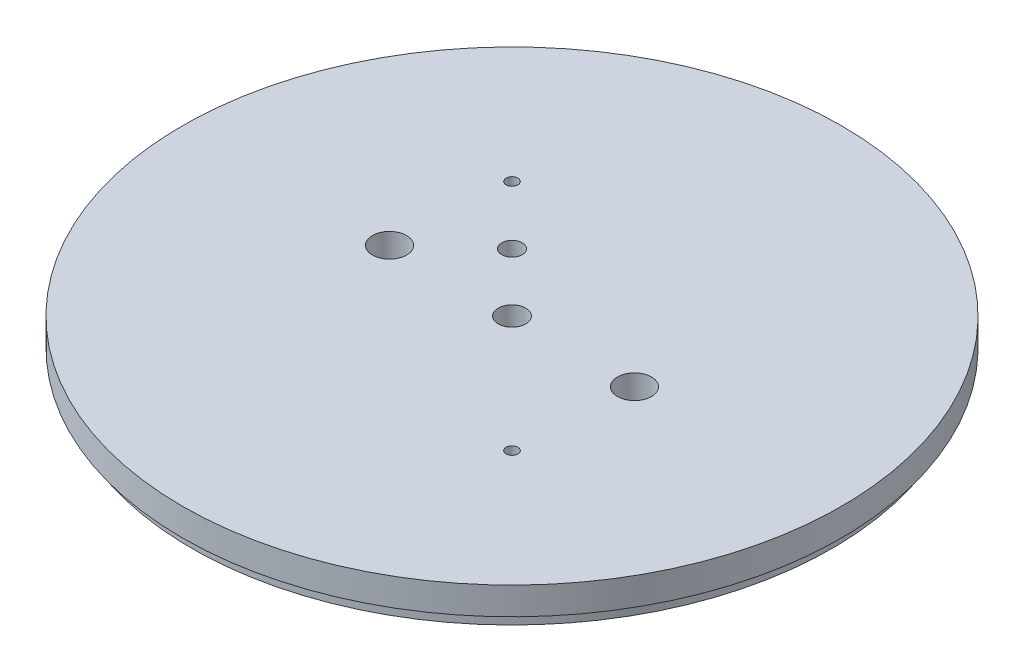
from build123d import *

# Parameters (mm, degrees)
SKETCH1_R           = 76.2
SKETCH1_R_2         = 3.175
SKETCH1_R_3         = 3.937
SKETCH1_R_4         = 1.3589
SKETCH1_R_5         = 2.38125
BOSS_EXTRUDE1_DEPTH = 9.525
SKETCH2_R           = 76.2
SKETCH2_R_2         = 74.041
CUT_EXTRUDE1_DEPTH  = 3.175
CUT_EXTRUDE2_START  = -5.969
CUT_EXTRUDE2_DEPTH  = 3.556


with BuildPart() as part:
    # Sketch1 → Boss-Extrude1 (new body)
    with BuildSketch(Plane(origin=(0, 0, 0), x_dir=(1, 0, 0), z_dir=(0, 1, 0))):
        Circle(SKETCH1_R)
        Circle(SKETCH1_R_2, mode=Mode.SUBTRACT)
        with Locations((28.321, 0)):
            Circle(SKETCH1_R_3, mode=Mode.SUBTRACT)
        with Locations((-28.321, 0)):
            Circle(SKETCH1_R_3, mode=Mode.SUBTRACT)
        with Locations((-26.940768363, 26.940768363)):
            Circle(SKETCH1_R_4, mode=Mode.SUBTRACT)
        with Locations((26.940768363, -26.940768363)):
            Circle(SKETCH1_R_4, mode=Mode.SUBTRACT)
        with Locations((-13.470384182, 13.470384182)):
            Circle(SKETCH1_R_5, mode=Mode.SUBTRACT)
    extrude(amount=BOSS_EXTRUDE1_DEPTH)

    # Sketch2 → Cut-Extrude1 (cut)
    with BuildSketch(Plane.XZ):
        Circle(SKETCH2_R)
        Circle(SKETCH2_R_2, mode=Mode.SUBTRACT)
    extrude(amount=-CUT_EXTRUDE1_DEPTH, mode=Mode.SUBTRACT)

    # Sketch3 → Cut-Extrude2 (cut)
    with BuildSketch(Plane(origin=(0, 9.525, 0), x_dir=(1, 0, 0), z_dir=(0, 1, 0)).offset(CUT_EXTRUDE2_START)):
        with BuildLine():
            Line((3.2385, 34.798), (3.2385, 13.97))
            ThreePointArc((3.2385, 13.97), (0, 10.7315), (-3.2385, 13.97))
            Line((-3.2385, 13.97), (-3.2385, 34.798))
            ThreePointArc((-3.2385, 34.798), (0, 38.0365), (3.2385, 34.798))
        make_face()
        with BuildLine():
            Line((3.2385, -34.798), (3.2385, -13.97))
            ThreePointArc((3.2385, -13.97), (0, -10.7315), (-3.2385, -13.97))
            Line((-3.2385, -13.97), (-3.2385, -34.798))
            ThreePointArc((-3.2385, -34.798), (0, -38.0365), (3.2385, -34.798))
        make_face()
    extrude(amount=-CUT_EXTRUDE2_DEPTH, mode=Mode.SUBTRACT)


solid = part.part
